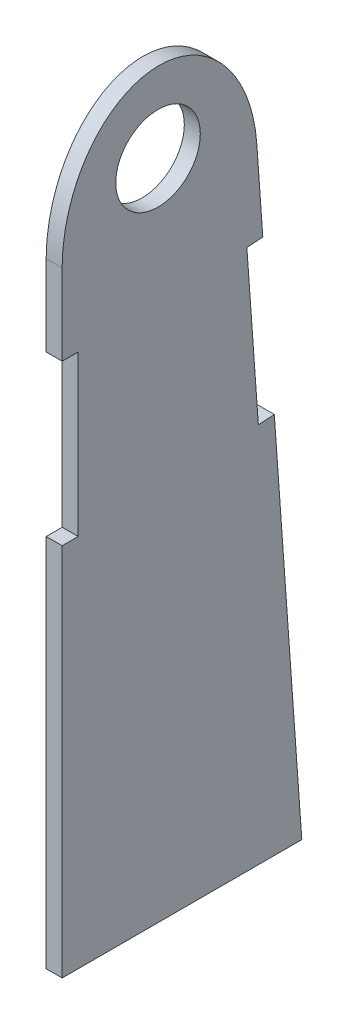
from build123d import *

# Parameters (mm, degrees)
BOSS_EXTRUDE1_DEPTH  = 1.5875
M8_CLEARANCE_HOLE1_D = 8.4
CUT_EXTRUDE1_DEPTH   = 68.327229715


with BuildPart() as part:
    # Sketch1 → Boss-Extrude1 (new body)
    with BuildSketch(Plane(origin=(0, 0, 0), x_dir=(0, 0, -1), z_dir=(1, 0, 0))):
        with BuildLine():
            Line((-9.525, -65.774638339), (0, -65.774638339))
            Line((0, -65.774638339), (14.2875, -65.774638339))
            Line((14.2875, -65.774638339), (11.553356238, -27.816833207))
            Line((11.553356238, -27.816833207), (9.96995864, -27.930887132))
            Line((9.96995864, -27.930887132), (8.829419389, -12.096911155))
            Line((8.829419389, -12.096911155), (10.412816987, -11.98285723))
            Line((10.412816987, -11.98285723), (9.500385586, 0.684323551))
            ThreePointArc((9.500385586, 0.684323551), (-0.342383043, 9.518844407), (-9.525, 0))
            Line((-9.525, 0), (-9.525, -12.7))
            Line((-9.525, -12.7), (-7.9375, -12.7))
            Line((-7.9375, -12.7), (-7.9375, -28.575))
            Line((-7.9375, -28.575), (-9.525, -28.575))
            Line((-9.525, -28.575), (-9.525, -65.774638339))
        make_face()
    extrude(amount=BOSS_EXTRUDE1_DEPTH)

    # M8 Clearance Hole1 (through all)
    with Locations(Plane(origin=(1.5875, 0, 0), x_dir=(0, 0, -1), z_dir=(1, 0, 0))):
        with Locations((0, 0)):
            Hole(M8_CLEARANCE_HOLE1_D / 2)

    # Sketch4 → Cut-Extrude1 (cut, through all)
    with BuildSketch(Plane(origin=(1.5875, 0, 0), x_dir=(0, 0, -1), z_dir=(1, 0, 0))):
        with BuildLine():
            add(Edge.make_bspline(
                [(9.813193489, -3.658352794), (8.943756668, 8.411939147), (-0.290621666, 7.927993001), (-9.525, 7.444046856), (-9.525, -4.671809667)],
                knots=[1.647896538, 1.647896538, 1.647896538, 3.171599371, 3.171599371, 4.695302204, 4.695302204, 4.695302204], degree=2, weights=[1, 0.723559289, 1, 0.723559289, 1]))
            Line((9.813193489, -3.658352794), (9.500385586, 0.684323551))
            ThreePointArc((9.500385586, 0.684323551), (-0.342383043, 9.518844407), (-9.525, 0))
            Line((-9.525, 0), (-9.525, -4.671809667))
        make_face()
    extrude(amount=-CUT_EXTRUDE1_DEPTH, mode=Mode.SUBTRACT)


solid = part.part
